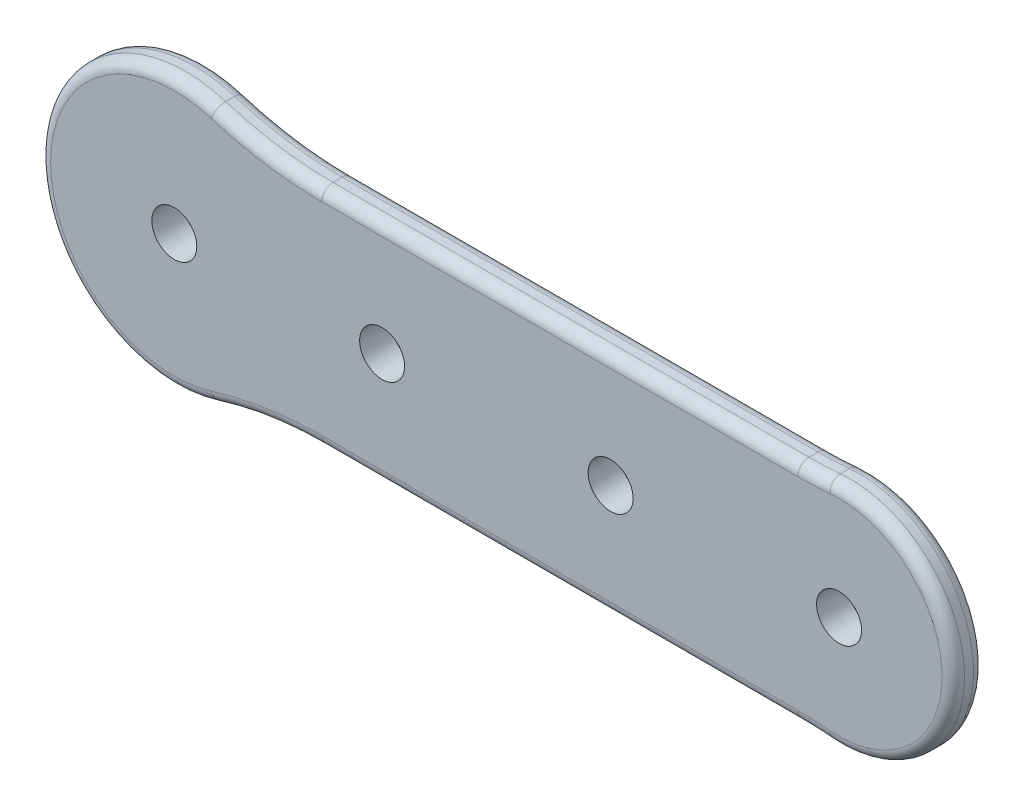
from build123d import *

# Parameters (mm, degrees)
SKETCH1_R           = 5
BOSS_EXTRUDE1_DEPTH = 7
FILLET1_R           = 80
FILLET2_R           = 2.5


with BuildPart() as part:
    # Sketch1 → Boss-Extrude1 (new body)
    with BuildSketch(Plane.XY):
        with BuildLine():
            ThreePointArc((-57.316876048, 25), (-103.9, 0), (-57.316876048, -25))
            Line((-57.316876048, -25), (69.410011136, -25))
            ThreePointArc((69.410011136, -25), (99.3, 0), (69.410011136, 25))
            Line((69.410011136, 25), (-57.316876048, 25))
        make_face()
        with Locations((-73.9, 0)):
            Circle(SKETCH1_R, mode=Mode.SUBTRACT)
        with Locations((-27.7, 0)):
            Circle(SKETCH1_R, mode=Mode.SUBTRACT)
        with Locations((23.1, 0)):
            Circle(SKETCH1_R, mode=Mode.SUBTRACT)
        with Locations((73.9, 0)):
            Circle(SKETCH1_R, mode=Mode.SUBTRACT)
    extrude(amount=BOSS_EXTRUDE1_DEPTH)

    # Fillet1
    fillet1_edges = [part.edges().sort_by_distance(p)[0] for p in [
        (69.410011136, -25, 3.5),
        (69.410011136, 25, 3.5),
        (-57.316876048, -25, 3.5),
        (-57.316876048, 25, 3.5),
    ]]
    fillet(fillet1_edges, radius=FILLET1_R)

    # Fillet2
    fillet2_edges = [part.edges().sort_by_distance(p)[0] for p in [
        (-53.173261162, 25.914315742, 7),
        (-103.9, 0, 7),
        (-53.173261162, -25.914315742, 7),
        (11.806658334, -25, 7),
        (68.210978782, -25.075937369, 7),
        (99.3, 0, 7),
        (68.210978782, 25.075937369, 7),
        (-53.173261162, 25.914315742, 0),
        (-103.9, 0, 0),
        (-53.173261162, -25.914315742, 0),
        (11.806658334, -25, 0),
        (68.210978782, -25.075937369, 0),
        (99.3, 0, 0),
        (68.210978782, 25.075937369, 0),
        (11.806658334, 25, 7),
        (11.806658334, 25, 0),
    ]]
    fillet(fillet2_edges, radius=FILLET2_R)


solid = part.part
